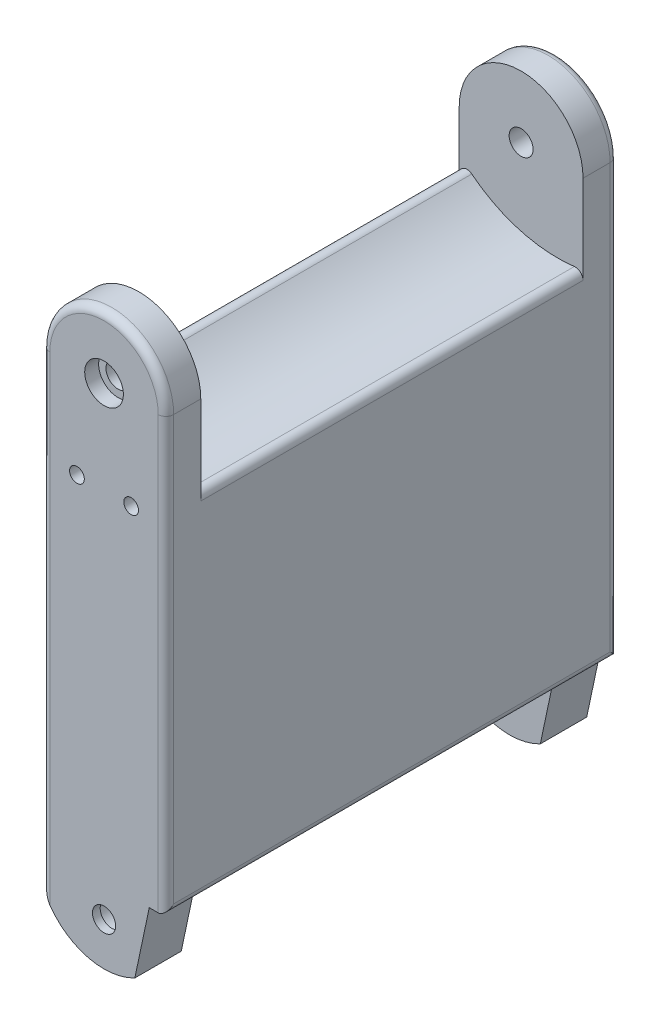
from build123d import *

# Parameters (mm, degrees)
SKETCH1_R                = 2
BOSS_EXTRUDE1_DEPTH      = 5
SKETCH2_R                = 1.5
BOSS_EXTRUDE2_DEPTH      = 15
SKETCH3_R                = 1.5
BOSS_EXTRUDE3_DEPTH      = 19.75
CROQUIS1_R               = 1.55
SALIENTE_EXTRUIR1_DEPTH  = 4.5
SALIENTE_EXTRUIR5_REACH  = 73.33
CROQUIS5_W               = 16
CROQUIS5_H               = 35.719654706
SALIENTE_EXTRUIR6_DEPTH  = 24.75
CROQUIS6_W               = 21.702147556
CROQUIS6_H               = 9.928090966
CORTAR_EXTRUIR1_DEPTH    = 13
CORTAR_EXTRUIR2_DEPTH    = 19.75
CROQUIS8_R               = 0.95
CORTAR_EXTRUIR3_DEPTH    = 4.75
SALIENTE_EXTRUIR7_DEPTH  = 3.45
CORTAR_EXTRUIR4_DEPTH    = 3
CORTAR_EXTRUIR5_DEPTH    = 16.5
CROQUIS14_R              = 1.5
SALIENTE_EXTRUIR8_DEPTH  = 1
SIMETR_A5_START          = -1
SIMETR_A5_OUTLINE_R      = 0.95
SIMETR_A5_DEPTH          = 1.3
SALIENTE_EXTRUIR9_START  = -4.5
CROQUIS15_R              = 1.55
SALIENTE_EXTRUIR9_DEPTH  = 4.5
SALIENTE_EXTRUIR10_START = 1
CROQUIS16_R              = 1.55
CROQUIS16_R_2            = 0.95
CROQUIS16_R_3            = 1.5
SALIENTE_EXTRUIR10_DEPTH = 1
CROQUIS17_R              = 2.5
CORTAR_EXTRUIR7_DEPTH    = 2
REDONDEO6_R              = 1
REDONDEO7_R              = 1
REDONDEO8_R              = 1


# Read off the part's stored shape, not the designer's step: Simetría5
with BuildPart() as part:
    # Sketch1 → Boss-Extrude1 (new body)
    with BuildSketch(Plane.XY):
        with BuildLine():
            Line((-8, 0), (-8, 37.32353581))
            Line((-8, 37.32353581), (8, 37.32353581))
            Line((8, 37.32353581), (8, 4.236047978))
            Line((8, 4.236047978), (5.844390358, 4.236047978))
            Line((5.844390358, 4.236047978), (3.979699792, -4.569047459))
            ThreePointArc((3.979699792, -4.569047459), (-3.04298408, -4.99253696), (-8, 0))
        make_face()
        Circle(SKETCH1_R, mode=Mode.SUBTRACT)
    extrude(amount=BOSS_EXTRUDE1_DEPTH)

    # Sketch2 → Boss-Extrude2 (add)
    with BuildSketch(Plane.XY.offset(5)):
        with Locations((0, 30)):
            Circle(SKETCH2_R)
    extrude(amount=BOSS_EXTRUDE2_DEPTH)

    # Sketch3 → Boss-Extrude3 (add)
    with BuildSketch(Plane.XY.offset(5)):
        with BuildLine():
            Line((-2.968624299, 23.290881231), (-2.968624299, 3.203458857))
            Line((-2.968624299, 3.203458857), (5, 3.203458857))
            Line((5, 3.203458857), (5, 0))
            ThreePointArc((5, 0), (3.535533906, -3.535533906), (0, -5))
            Line((0, -5), (-3, -5))
            Line((-3, -5), (-6.244997998, -5))
            ThreePointArc((-6.244997998, -5), (-7.548509256, -2.649529771), (-8, 0))
            Line((-8, 0), (-8, 30))
            Line((-8, 30), (-2.968624299, 23.290881231))
        make_face()
        Circle(SKETCH3_R, mode=Mode.SUBTRACT)
    extrude(amount=BOSS_EXTRUDE3_DEPTH)

    # Croquis1 → Saliente-Extruir1 (add)
    with BuildSketch(Plane.XY.offset(20)):
        with BuildLine():
            Line((8, 30), (8, 60))
            ThreePointArc((8, 60), (0, 68), (-8, 60))
            Line((-8, 60), (-8, 30))
            ThreePointArc((-8, 30), (0, 22), (8, 30))
        make_face()
        with Locations((0, 60)):
            Circle(CROQUIS1_R, mode=Mode.SUBTRACT)
    saliente_extruir1 = extrude(amount=SALIENTE_EXTRUIR1_DEPTH)

    # Saliente-Extruir5: up to this face of the body (flat: up to its plane)
    saliente_extruir5_end = Plane(part.part.faces().sort_by_distance((-0.202248034, 17.4746777, 0))[0])
    # Croquis4 → Saliente-Extruir5 (add, up to the picked face)
    with BuildSketch(Plane(origin=(0, 0, 20), x_dir=(-1, 0, 0), z_dir=(0, 0, -1)), mode=Mode.PRIVATE) as saliente_extruir5_sk1:
        with BuildLine():
            Line((8, 32.729705588), (8, 54.729705588))
            ThreePointArc((8, 54.729705588), (0.622079601, 50.239050865), (-8, 49.729705588))
            Line((-8, 49.729705588), (-8, 32.729705588))
            Line((-8, 32.729705588), (8, 32.729705588))
        make_face()
    saliente_extruir5_tool1 = split(extrude(saliente_extruir5_sk1.sketch, amount=SALIENTE_EXTRUIR5_REACH, mode=Mode.PRIVATE), bisect_by=saliente_extruir5_end, keep=Keep.BOTH, mode=Mode.PRIVATE)
    add(saliente_extruir5_tool1.solids().sort_by(Axis((-0.349387, 41.805362, 20), (0, 0, -1)))[0])

    # Croquis5 → Saliente-Extruir6 (add)
    with BuildSketch(Plane(origin=(0, 0, 0), x_dir=(-1, 0, 0), z_dir=(0, 0, -1))):
        with Locations((0, 22.095875331)):
            Rectangle(CROQUIS5_W, CROQUIS5_H)
    extrude(amount=-SALIENTE_EXTRUIR6_DEPTH)

    # Croquis6 → Cortar-Extruir1 (cut)
    with BuildSketch(Plane(origin=(5, 0, 0), x_dir=(0, 0, -1), z_dir=(1, 0, 0))):
        with Locations((-15.851073778, -1.760586626)):
            Rectangle(CROQUIS6_W, CROQUIS6_H)
    extrude(amount=-CORTAR_EXTRUIR1_DEPTH, mode=Mode.SUBTRACT)

    # Croquis7 → Cortar-Extruir2 (cut)
    with BuildSketch(Plane.XY.offset(24.75)):
        with BuildLine():
            Line((-8, 3.203458857), (8, 3.203458857))
            Line((8, 3.203458857), (8, 3.520097758))
            ThreePointArc((8, 3.520097758), (-0.079264703, 7.367082887), (-8, 3.203458857))
        make_face()
    extrude(amount=-CORTAR_EXTRUIR2_DEPTH, mode=Mode.SUBTRACT)

    # Croquis8 → Cortar-Extruir3 (cut)
    with BuildSketch(Plane.XY.offset(24.75)):
        with Locations((3.5, 48)):
            Circle(CROQUIS8_R)
        with Locations((-3.5, 48)):
            Circle(CROQUIS8_R)
    cortar_extruir3 = extrude(amount=-CORTAR_EXTRUIR3_DEPTH, mode=Mode.SUBTRACT)

    # Croquis9 → Saliente-Extruir7 (add, symmetric)
    with BuildSketch(Plane.XY.offset(24.75)):
        with BuildLine():
            Line((-8, 40.520097758), (-8, 3.203458857))
            ThreePointArc((-8, 3.203458857), (-0.665608426, 7.324319495), (7.159822628, 4.236047978))
            Line((7.159822628, 4.236047978), (8, 4.236047978))
            Line((8, 4.236047978), (8, 49.729705588))
            ThreePointArc((8, 49.729705588), (-0.622079601, 50.239050865), (-8, 54.729705588))
            Line((-8, 54.729705588), (-8, 40.520097758))
        make_face()
    extrude(amount=SALIENTE_EXTRUIR7_DEPTH, both=True)

    # Simetría1: part across plane


with BuildPart() as part_1:
    add(part.part)
    add(part.part.mirror(Plane(origin=(4.712433071, 67.309491417, 28.2), x_dir=(1, 0, 0), z_dir=(0, 0, -1))))

    # Croquis10 → Cortar-Extruir4 (cut)
    with BuildSketch(Plane(origin=(0, 0, 31.9), x_dir=(-1, 0, 0), z_dir=(0, 0, -1))):
        Polygon((2.51627812, 61.936924819), (-0.419287038, 63.147623185), (-2.935565159, 61.210698366), (-2.51627812, 58.063075181), (0.419287038, 56.852376815), (2.935565159, 58.789301634), align=None)
    extrude(amount=-CORTAR_EXTRUIR4_DEPTH, mode=Mode.SUBTRACT)

    # Simetría3: Saliente-Extruir1, Cortar-Extruir3 across plane
    add(saliente_extruir1.mirror(Plane.XY.offset(38.7)))
    add(cortar_extruir3.mirror(Plane.XY.offset(38.7)), mode=Mode.SUBTRACT)

    # Croquis12 → Cortar-Extruir5 (cut, symmetric)
    with BuildSketch(Plane.XY.offset(36.4)):
        with BuildLine():
            Line((-8, 54.729705588), (-10.312115974, 60.381035393))
            Line((-10.312115974, 60.381035393), (-8.568993542, 74.199141583))
            Line((-8.568993542, 74.199141583), (17.131520351, 70.957080647))
            Line((17.131520351, 70.957080647), (14.495741362, 50.062694062))
            Line((14.495741362, 50.062694062), (8, 49.729705588))
            ThreePointArc((8, 49.729705588), (-0.622079601, 50.239050865), (-8, 54.729705588))
        make_face()
    extrude(amount=CORTAR_EXTRUIR5_DEPTH, both=True, mode=Mode.SUBTRACT)

    # Croquis14 → Saliente-Extruir8 (add)
    with BuildSketch(Plane(origin=(0, 0, 0), x_dir=(-1, 0, 0), z_dir=(0, 0, -1))):
        with BuildLine():
            Line((-8, 49.729705588), (-8, 4.236047978))
            Line((-8, 4.236047978), (-5.844390358, 4.236047978))
            Line((-5.844390358, 4.236047978), (-3.979699792, -4.569047459))
            ThreePointArc((-3.979699792, -4.569047459), (3.04298408, -4.99253696), (8, 0))
            Line((8, 0), (8, 54.729705588))
            ThreePointArc((8, 54.729705588), (0.622079601, 50.239050865), (-8, 49.729705588))
        make_face()
        Circle(CROQUIS14_R, mode=Mode.SUBTRACT)
    extrude(amount=SALIENTE_EXTRUIR8_DEPTH)

    # Simetría5 outline → Simetría5 (cut)
    with BuildSketch(Plane.XY.offset(SIMETR_A5_START)):
        with Locations((-3.5, 48)):
            Circle(SIMETR_A5_OUTLINE_R)
        with Locations((3.5, 48)):
            Circle(SIMETR_A5_OUTLINE_R)
    extrude(amount=SIMETR_A5_DEPTH, mode=Mode.SUBTRACT)

    # Croquis15 → Saliente-Extruir9 (add)
    with BuildSketch(Plane(origin=(0, 0, -1), x_dir=(-1, 0, 0), z_dir=(0, 0, -1)).offset(SALIENTE_EXTRUIR9_START)):
        with BuildLine():
            Line((-8, 49.729705588), (-8, 60))
            ThreePointArc((-8, 60), (0, 68), (8, 60))
            Line((8, 60), (8, 54.729705588))
            ThreePointArc((8, 54.729705588), (0.622079601, 50.239050865), (-8, 49.729705588))
        make_face()
        with Locations(Location((0, 60, 0), (0, 0, 180))):
            Circle(CROQUIS15_R, mode=Mode.SUBTRACT)
    extrude(amount=SALIENTE_EXTRUIR9_DEPTH)

    # Croquis16 → Saliente-Extruir10 (add)
    with BuildSketch(Plane.XY.offset(56.4).offset(SALIENTE_EXTRUIR10_START)):
        with BuildLine():
            Line((-8, 0), (-8, 60))
            ThreePointArc((-8, 60), (0, 68), (8, 60))
            Line((8, 60), (8, 4.236047978))
            Line((8, 4.236047978), (5.844390358, 4.236047978))
            Line((5.844390358, 4.236047978), (3.979699792, -4.569047459))
            ThreePointArc((3.979699792, -4.569047459), (-3.04298408, -4.99253696), (-8, 0))
        make_face()
        with Locations((0, 60)):
            Circle(CROQUIS16_R, mode=Mode.SUBTRACT)
        with Locations(Location((3.5, 48, 0), (0, 0, 180))):
            Circle(CROQUIS16_R_2, mode=Mode.SUBTRACT)
        with Locations(Location((-3.5, 48, 0), (0, 0, 180))):
            Circle(CROQUIS16_R_2, mode=Mode.SUBTRACT)
        with Locations(Location((0, 0, 0), (0, 0, 180))):
            Circle(CROQUIS16_R_3, mode=Mode.SUBTRACT)
    extrude(amount=-SALIENTE_EXTRUIR10_DEPTH)

    # Croquis17 → Cortar-Extruir7 (cut)
    with BuildSketch(Plane(origin=(0, 0, -1), x_dir=(-1, 0, 0), z_dir=(0, 0, -1))):
        with Locations((0, 60)):
            Circle(CROQUIS17_R)
    cortar_extruir7 = extrude(amount=-CORTAR_EXTRUIR7_DEPTH, mode=Mode.SUBTRACT)

    # Simetría6: Cortar-Extruir7 across plane
    add(cortar_extruir7.mirror(Plane.XY.offset(28.3)), mode=Mode.SUBTRACT)

    # Redondeo6
    # the kernel refuses this fillet: 1 mm, written as the material it takes off along each edge
    with BuildSketch(Plane(origin=(-8, 60, -1), x_dir=(0, 0, 1), z_dir=(0, -1, 0)), Plane(origin=(-8, -2.5, 57.4), x_dir=(0, 0, -1), z_dir=(0, 1, 0))) as redondeo6_piece_1:
        with BuildLine():
            CenterArc((REDONDEO6_R, -REDONDEO6_R), REDONDEO6_R, 90, 90)
            Line((0, -REDONDEO6_R), (0, 0))
            Line((0, 0), (REDONDEO6_R, 0))
        make_face()
    extrude(amount=62.5, mode=Mode.SUBTRACT)
    with BuildSketch(Plane(origin=(0, 60, -1), x_dir=(1, 0, 0), z_dir=(0, -1, 0))) as redondeo6_piece_2:
        with BuildLine():
            CenterArc((8 - REDONDEO6_R, REDONDEO6_R), REDONDEO6_R, 270, 90)
            Line((8 - REDONDEO6_R, 0), (8, 0))
            Line((8, 0), (8, REDONDEO6_R))
        make_face()
    revolve(axis=Axis((0, 60, -1), (0, 0, 1)), revolution_arc=180, mode=Mode.SUBTRACT)
    with BuildSketch(Plane(origin=(8, 60, -1), x_dir=(-1, 0, 0), z_dir=(0, -1, 0))) as redondeo6_piece_3:
        with BuildLine():
            CenterArc((REDONDEO6_R, -REDONDEO6_R), REDONDEO6_R, 90, 90)
            Line((0, -REDONDEO6_R), (0, 0))
            Line((0, 0), (REDONDEO6_R, 0))
        make_face()
    extrude(amount=58.263952022, mode=Mode.SUBTRACT)
    with BuildSketch(Plane(origin=(8, 4.236047978, 59.9), x_dir=(0, 1, 0), z_dir=(0, 0, -1))) as redondeo6_piece_4:
        with BuildLine():
            CenterArc((REDONDEO6_R, -REDONDEO6_R), REDONDEO6_R, 90, 90)
            Line((0, -REDONDEO6_R), (0, 0))
            Line((0, 0), (REDONDEO6_R, 0))
        make_face()
    extrude(amount=63.4, mode=Mode.SUBTRACT)
    with BuildSketch(Plane(origin=(8, 60, 57.4), x_dir=(-1, 0, 0), z_dir=(0, -1, 0))) as redondeo6_piece_5:
        with BuildLine():
            CenterArc((REDONDEO6_R, REDONDEO6_R), REDONDEO6_R, 180, 90)
            Line((0, REDONDEO6_R), (0, 0))
            Line((0, 0), (REDONDEO6_R, 0))
        make_face()
    extrude(amount=58.263952022, mode=Mode.SUBTRACT)
    with BuildSketch(Plane(origin=(0, 60, 57.4), x_dir=(1, 0, 0), z_dir=(0, -1, 0))) as redondeo6_piece_6:
        with BuildLine():
            CenterArc((8 - REDONDEO6_R, -REDONDEO6_R), REDONDEO6_R, 0, 90)
            Line((8, -REDONDEO6_R), (8, 0))
            Line((8, 0), (8 - REDONDEO6_R, 0))
        make_face()
    revolve(axis=Axis((0, 60, 57.4), (0, 0, 1)), revolution_arc=180, mode=Mode.SUBTRACT)

    # Redondeo7
    redondeo7_edges = [part_1.edges().sort_by_distance(p)[0] for p in [
        (8, 49.729705588, 28.2),
    ]]
    fillet(redondeo7_edges, radius=REDONDEO7_R)

    # Redondeo8
    redondeo8_edges = [part_1.edges().sort_by_distance(p)[0] for p in [
        (-8, 54.729705588, 28.2),
    ]]
    fillet(redondeo8_edges, radius=REDONDEO8_R)


solid = part_1.part
